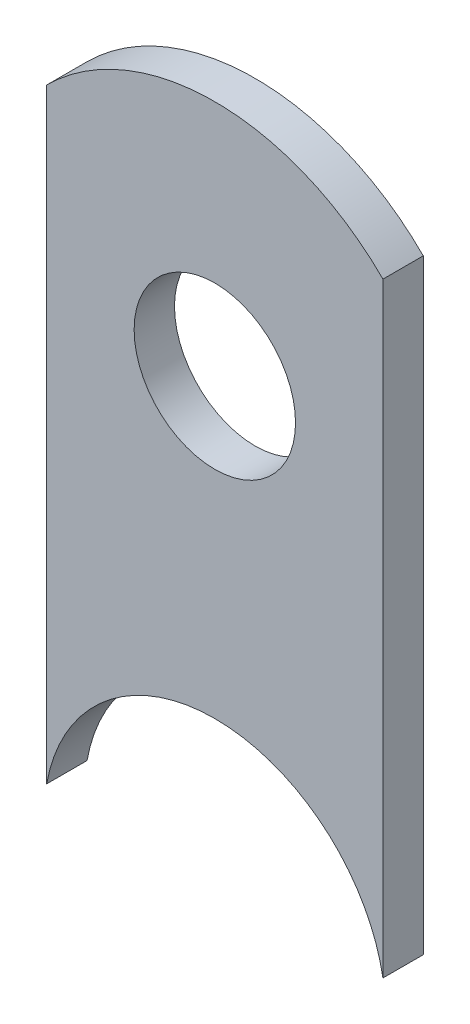
from build123d import *

# Parameters (mm, degrees)
SKETCH1_R          = 6
BASE_FLANGE1_DEPTH = 3


# Sheet-metal steps are written as plain solids
with BuildPart() as part:
    # Sketch1 → Base-Flange1 (new body)
    with BuildSketch(Plane.XY):
        with BuildLine():
            Line((-12.5, 22.5), (-12.5, -22.5))
            ThreePointArc((-12.5, -22.5), (0, -12.044994432), (12.5, -22.5))
            Line((12.5, -22.5), (12.5, 22.5))
            ThreePointArc((12.5, 22.5), (0, 27.67766953), (-12.5, 22.5))
        make_face()
        with Locations((0, 10)):
            Circle(SKETCH1_R, mode=Mode.SUBTRACT)
    extrude(amount=-BASE_FLANGE1_DEPTH)


solid = part.part
